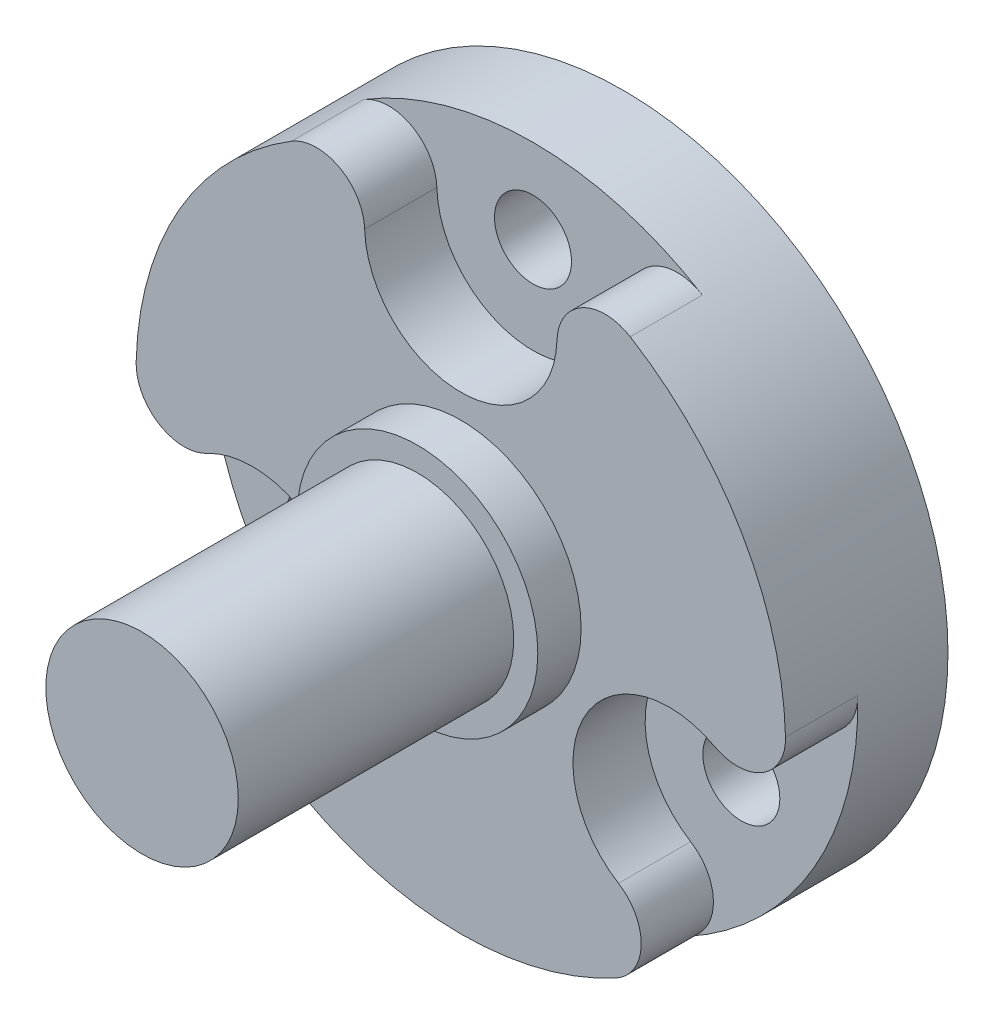
from build123d import *

# Parameters (mm, degrees)
SKETCH_1_R          = 13.5
EXTRUDE_1_DEPTH     = 20
SKETCH_2_R          = 1.6
CUT_EXTRUDE_1_DEPTH = 28.649593125
CUT_EXTRUDE_START   = -13.25
SKETCH_3_R          = 13.5
SKETCH_3_R_2        = 4
CUT_EXTRUDE_4_DEPTH = 13.25
SKETCH_4_R          = 5
SKETCH_4_R_2        = 4
EXTRUDE_2_DEPTH     = 1.8
SKETCH_5_R          = 4
SKETCH_5_R_2        = 1.6
CUT_EXTRUDE_6_DEPTH = 3
FILLET_1_R          = 2


with BuildPart() as part:
    # ｽｹｯﾁ1 → ﾎﾞｽ - 押し出し1 (new body)
    with BuildSketch(Plane.XY):
        Circle(SKETCH_1_R)
    extrude(amount=EXTRUDE_1_DEPTH)

    # ｽｹｯﾁ2 → ｶｯﾄ - 押し出し1 (cut, through all)
    with BuildSketch(Plane.XY.offset(20)):
        with Locations((0, 10)):
            Circle(SKETCH_2_R)
        with Locations((8.660254038, -5)):
            Circle(SKETCH_2_R)
        with Locations((-8.660254038, -5)):
            Circle(SKETCH_2_R)
    extrude(amount=-CUT_EXTRUDE_1_DEPTH, mode=Mode.SUBTRACT)

    # ｽｹｯﾁ3 → ｶｯﾄ - 押し出し4 (cut)
    with BuildSketch(Plane.XY.offset(20).offset(CUT_EXTRUDE_START)):
        Circle(SKETCH_3_R)
        Circle(SKETCH_3_R_2, mode=Mode.SUBTRACT)
    extrude(amount=CUT_EXTRUDE_4_DEPTH, mode=Mode.SUBTRACT)

    # ｽｹｯﾁ4 → ﾎﾞｽ - 押し出し2 (add)
    with BuildSketch(Plane.XY.offset(6.75)):
        Circle(SKETCH_4_R)
        Circle(SKETCH_4_R_2, mode=Mode.SUBTRACT)
    extrude(amount=EXTRUDE_2_DEPTH)

    # ｽｹｯﾁ5 → ｶｯﾄ - 押し出し6 (cut)
    # profile 1 of 3: a face of its own
    with BuildSketch(Plane.XY.offset(6.75)):
        with Locations((0, 10)):
            Circle(SKETCH_5_R)
        with Locations((0, 10)):
            Circle(SKETCH_5_R_2, mode=Mode.SUBTRACT)
    # profile 2 of 3: a face of its own
    with BuildSketch(Plane.XY.offset(6.75)):
        with Locations((8.660254038, -5)):
            Circle(SKETCH_5_R)
        with Locations((8.660254038, -5)):
            Circle(SKETCH_5_R_2, mode=Mode.SUBTRACT)
    # profile 3 of 3: a face of its own
    with BuildSketch(Plane.XY.offset(6.75)):
        with Locations((-8.660254038, -5)):
            Circle(SKETCH_5_R)
        with Locations((-8.660254038, -5)):
            Circle(SKETCH_5_R_2, mode=Mode.SUBTRACT)
    extrude(amount=-CUT_EXTRUDE_6_DEPTH, mode=Mode.SUBTRACT)

    # ﾌｨﾚｯﾄ1
    # the kernel refuses this fillet: 2 mm, written as the material it takes off along each edge
    with BuildSketch(Plane(origin=(-10.407876243, -8.598029548, 19.555288564), x_dir=(0.7715815777995733, -0.6361303866349423, 0), z_dir=(0, 0, -1)), Plane(origin=(12.650050133, -4.714470452, 19.555288564), x_dir=(0.1651142860452898, 0.9862744407839807, 0), z_dir=(0, 0, -1)), Plane(origin=(-2.242173889, 13.3125, 19.555288564), x_dir=(-0.9366958638448638, -0.35014405414903826, 0), z_dir=(0, 0, -1))) as fillet_1_piece_1:
        with BuildLine():
            CenterArc((4.742699468, -1.963681118), FILLET_1_R, 79.064257334, 119.641084367)
            ThreePointArc((2.848338702, -2.605083713), (1.759195342, -0.936232133), (0, 0))
            ThreePointArc((0, 0), (2.561057713, 0.245152457), (5.122115425, 0))
        make_face()
    extrude(amount=15.805288564, mode=Mode.SUBTRACT)
    with BuildSketch(Plane(origin=(-12.650050133, -4.714470452, 19.555288564), x_dir=(-0.16511428604529083, 0.9862744407839806, 0), z_dir=(0, 0, -1)), Plane(origin=(10.407876243, -8.598029548, 19.555288564), x_dir=(-0.7715815777995731, -0.6361303866349423, 0), z_dir=(0, 0, -1)), Plane(origin=(2.242173889, 13.3125, 19.555288564), x_dir=(0.9366958638448638, -0.35014405414903793, 0), z_dir=(0, 0, -1))) as fillet_1_piece_2:
        with BuildLine():
            CenterArc((4.742699468, 1.963681118), FILLET_1_R, 161.294658299, 119.641084367)
            ThreePointArc((2.848338702, 2.605083713), (1.759195342, 0.936232133), (0, 0))
            ThreePointArc((0, 0), (2.561057713, -0.245152457), (5.122115425, 0))
        make_face()
    extrude(amount=15.805288564, mode=Mode.SUBTRACT)


solid = part.part
